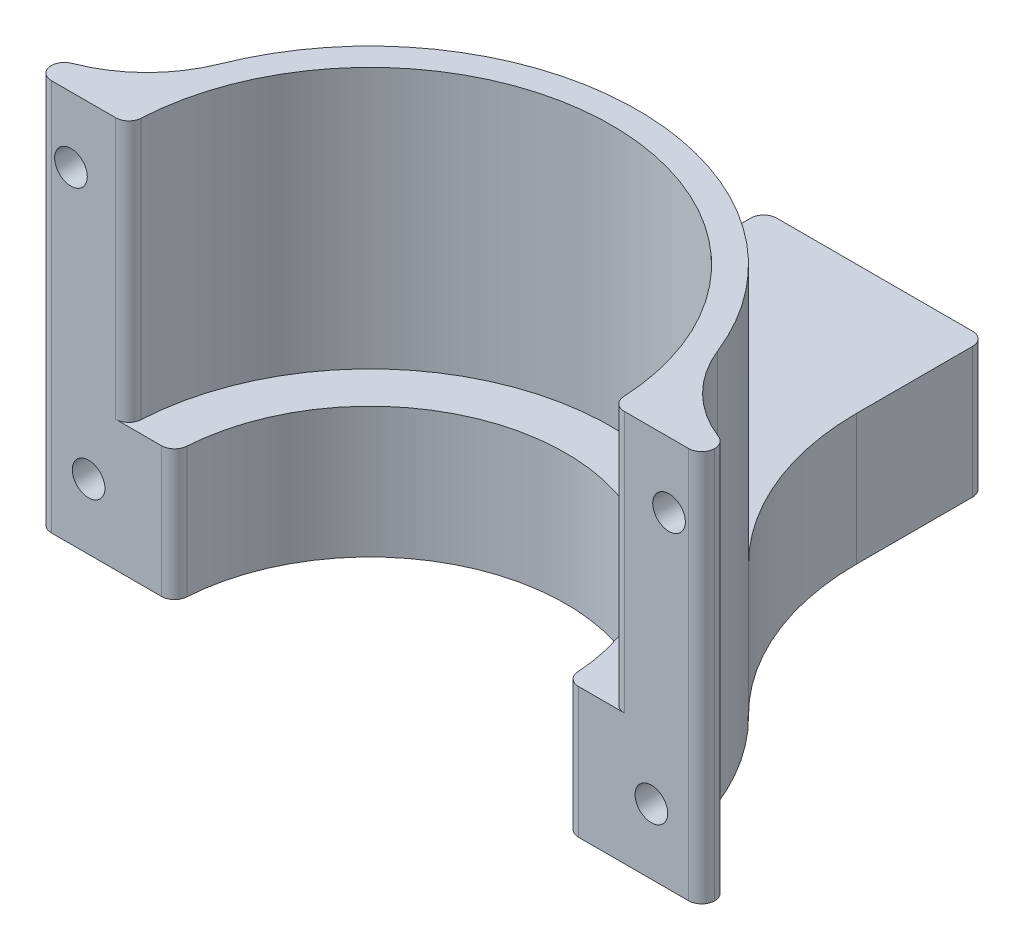
from build123d import *

# Parameters (mm, degrees)
ESQUISSE1_W                               = 17
ESQUISSE1_H                               = 10
BOSS_EXTRU_1_DEPTH                        = 20
TROUS_DE_CENTRAGE_5_0MM1_D                = 5
TROUS_DE_CENTRAGE_5_0MM1_DEPTH            = 10
TROUS_DE_CENTRAGE_5_0MM1_TIP              = 1.502151548
BOSS_EXTRU_2_DEPTH                        = 20
BOSS_EXTRU_3_START                        = 10
BOSS_EXTRU_3_DEPTH                        = 10
CONG_1_R                                  = 20
TROU_POUR_TARAUDAGE_POUR_TROU_TARAUD_M3_D = 2.5
CONG_2_R                                  = 1
CONG_3_START                              = -5
CONG_3_DEPTH                              = 30
CONG_3_START_2                            = 32
CONG_3_2_OUTLINE_R                        = 1.25
CONG_3_2_DEPTH                            = 4.654758106


with BuildPart() as part:
    # Esquisse1 → Boss.-Extru.1 (new body)
    with BuildSketch(Plane.XY):
        Rectangle(ESQUISSE1_W, ESQUISSE1_H)
    extrude(amount=BOSS_EXTRU_1_DEPTH)

    # Trous de centrage Ø5.0mm1
    with Locations(Plane(origin=(0, 0, 0), x_dir=(-1, 0, 0), z_dir=(0, 0, -1))):
        with Locations((0, 0)):
            Hole(TROUS_DE_CENTRAGE_5_0MM1_D / 2, depth=TROUS_DE_CENTRAGE_5_0MM1_DEPTH)
            with Locations((0, 0, -(TROUS_DE_CENTRAGE_5_0MM1_DEPTH + TROUS_DE_CENTRAGE_5_0MM1_TIP / 2))):  # 118° drill point
                Cone(0, TROUS_DE_CENTRAGE_5_0MM1_D / 2, TROUS_DE_CENTRAGE_5_0MM1_TIP, mode=Mode.SUBTRACT)

    # Esquisse4 → Boss.-Extru.2 (add)
    with BuildSketch(Plane(origin=(0, 5, 0), x_dir=(1, 0, 0), z_dir=(0, 1, 0))):
        with BuildLine():
            Line((18.5, -38.654758106), (25.402205763, -38.654758106))
            Line((25.402205763, -38.654758106), (25.402205763, -36.654758106))
            Line((25.402205763, -36.654758106), (20.402205763, -36.654758106))
            ThreePointArc((20.402205763, -36.654758106), (0, -18.154758106), (-20.402205763, -36.654758106))
            Line((-20.402205763, -36.654758106), (-25.402205763, -36.654758106))
            Line((-25.402205763, -36.654758106), (-25.402205763, -38.654758106))
            Line((-25.402205763, -38.654758106), (-18.5, -38.654758106))
            ThreePointArc((-18.5, -38.654758106), (0, -20.154758106), (18.5, -38.654758106))
        make_face()
    extrude(amount=BOSS_EXTRU_2_DEPTH)

    # Esquisse5 → Boss.-Extru.3 (add)
    with BuildSketch(Plane.XZ.offset(-5).offset(BOSS_EXTRU_3_START)):
        with BuildLine():
            Line((-18.5, 38.654758106), (-15, 38.654758106))
            ThreePointArc((-15, 38.654758106), (0, 23.654758106), (15, 38.654758106))
            Line((15, 38.654758106), (18.5, 38.654758106))
            Line((18.5, 38.654758106), (25.402205763, 38.654758106))
            Line((25.402205763, 38.654758106), (25.402205763, 36.654758106))
            Line((25.402205763, 36.654758106), (20.402205763, 36.654758106))
            ThreePointArc((20.402205763, 36.654758106), (16.678717468, 26.735429953), (8.5, 20))
            Line((8.5, 20), (-8.5, 20))
            ThreePointArc((-8.5, 20), (-16.678717468, 26.735429953), (-20.402205763, 36.654758106))
            Line((-20.402205763, 36.654758106), (-25.402205763, 36.654758106))
            Line((-25.402205763, 36.654758106), (-25.402205763, 38.654758106))
            Line((-25.402205763, 38.654758106), (-18.5, 38.654758106))
        make_face()
    extrude(amount=-BOSS_EXTRU_3_DEPTH)

    # Congé1
    cong_1_edges = [part.edges().sort_by_distance(p)[0] for p in [
        (-8.5, 0, 20),
        (8.5, 0, 20),
    ]]
    fillet(cong_1_edges, radius=CONG_1_R)

    # Trou pour taraudage pour trou taraudé M31 (through all)
    with Locations(Plane.XY.offset(38.654758106)):
        with Locations((-22.902205763, 20), (-21.551356318, 0), (21.551356318, 0), (22.902205763, 20)):
            Hole(TROU_POUR_TARAUDAGE_POUR_TROU_TARAUD_M3_D / 2)

    # Congé2
    cong_2_edges = [part.edges().sort_by_distance(p)[0] for p in [
        (-15, 0, 38.654758106),
        (-8.5, 0, 0),
        (8.5, 0, 0),
        (25.402205763, 10, 36.654758106),
        (-25.402205763, 10, 36.654758106),
        (25.402205763, 10, 38.654758106),
        (18.5, 15, 38.654758106),
        (-18.5, 15, 38.654758106),
        (15, 0, 38.654758106),
        (-25.402205763, 10, 38.654758106),
    ]]
    fillet(cong_2_edges, radius=CONG_2_R - 0.0001)  # a hair under: the kernel refuses the full size

    # Congé3: read off the stored shape, not the designer's step
    # Congé3 outline → Congé3 (add)
    with BuildSketch(Plane(origin=(0, 0, 0), x_dir=(1, 0, 0), z_dir=(0, 1, 0)).offset(CONG_3_START)):
        with BuildLine():
            ThreePointArc((-20.402205763, -36.654758106), (-19.921613651, -33.819542541), (-19.049016512, -31.079471318))
            ThreePointArc((-19.049016512, -31.079471318), (-21.313684521, -34.498543554), (-24.760297938, -36.721071866))
            ThreePointArc((-24.760297938, -36.721071866), (-24.584296071, -36.671476295), (-24.402205763, -36.654758106))
            Line((-24.402205763, -36.654758106), (-20.402205763, -36.654758106))
        make_face()
        with BuildLine():
            ThreePointArc((24.760297938, -36.721071866), (21.313684521, -34.498543554), (19.049016512, -31.079471318))
            ThreePointArc((19.049016512, -31.079471318), (19.921613651, -33.819542541), (20.402205763, -36.654758106))
            Line((20.402205763, -36.654758106), (24.402205763, -36.654758106))
            ThreePointArc((24.402205763, -36.654758106), (24.584296071, -36.671476295), (24.760297938, -36.721071866))
        make_face()
    extrude(amount=CONG_3_DEPTH)

    # Cong_3 2 outline → Cong_3 2 (cut)
    with BuildSketch(Plane.XY.offset(CONG_3_START_2)):
        with Locations((22.902205763, 20)):
            Circle(CONG_3_2_OUTLINE_R)
        with Locations((21.551356318, 0)):
            Circle(CONG_3_2_OUTLINE_R)
        with Locations((-21.551356318, 0)):
            Circle(CONG_3_2_OUTLINE_R)
        with Locations((-22.902205763, 20)):
            Circle(CONG_3_2_OUTLINE_R)
    extrude(amount=CONG_3_2_DEPTH, mode=Mode.SUBTRACT)


solid = part.part
